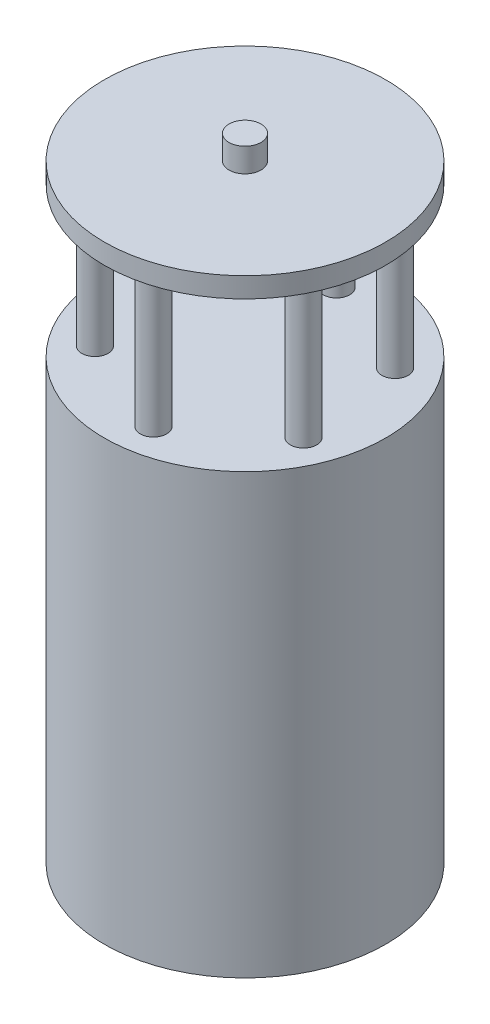
from build123d import *

# Parameters (mm, degrees)
SKETCH1_R           = 27.955
BOSS_EXTRUDE1_DEPTH = 4
SKETCH2_R           = 3.175
BOSS_EXTRUDE2_DEPTH = 4.76
SKETCH3_R           = 2.615316251
BOSS_EXTRUDE3_DEPTH = 29.718
BOSS_EXTRUDE4_START = 87.122
SKETCH4_R           = 27.955
BOSS_EXTRUDE4_DEPTH = 87.122
SKETCH5_R           = 22.758745994
CUT_EXTRUDE1_DEPTH  = 80


with BuildPart() as part:
    # Sketch1 → Boss-Extrude1 (new body)
    with BuildSketch(Plane(origin=(0, 0, 0), x_dir=(1, 0, 0), z_dir=(0, 1, 0))):
        Circle(SKETCH1_R)
    extrude(amount=BOSS_EXTRUDE1_DEPTH)

    # Sketch2 → Boss-Extrude2 (add)
    with BuildSketch(Plane(origin=(0, 4, 0), x_dir=(1, 0, 0), z_dir=(0, 1, 0))):
        Circle(SKETCH2_R)
    extrude(amount=BOSS_EXTRUDE2_DEPTH)

    # Sketch3 → Boss-Extrude3 (add)
    with BuildSketch(Plane.XZ):
        with Locations((19.676080545, 8.041325394)):
            Circle(SKETCH3_R)
        with Locations((16.802032343, -13.019322902)):
            Circle(SKETCH3_R)
        with Locations((2.874048201, 21.060648295)):
            Circle(SKETCH3_R)
        with Locations((-2.874048201, -21.060648295)):
            Circle(SKETCH3_R)
        with Locations((-16.802032343, 13.019322902)):
            Circle(SKETCH3_R)
        with Locations((-19.676080545, -8.041325394)):
            Circle(SKETCH3_R)
    extrude(amount=BOSS_EXTRUDE3_DEPTH)

    # Sketch4 → Boss-Extrude4 (add)
    with BuildSketch(Plane.XZ.offset(29.718).offset(BOSS_EXTRUDE4_START)):
        Circle(SKETCH4_R)
    extrude(amount=-BOSS_EXTRUDE4_DEPTH)

    # Sketch5 → Cut-Extrude1 (cut)
    with BuildSketch(Plane.XZ.offset(116.84)):
        Circle(SKETCH5_R)
    extrude(amount=-CUT_EXTRUDE1_DEPTH, mode=Mode.SUBTRACT)


solid = part.part
